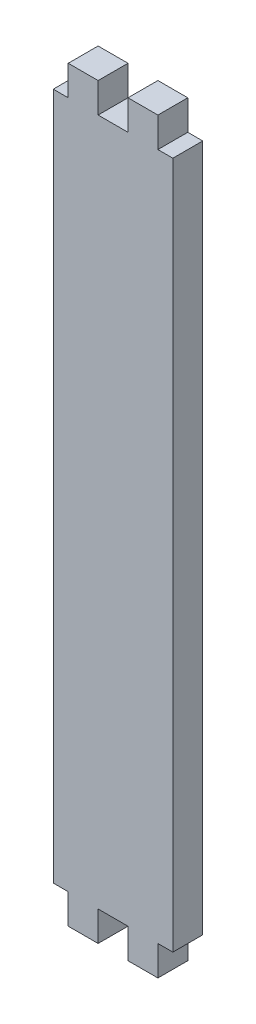
from build123d import *

# Parameters (mm, degrees)
BOSS_EXTRUDE1_DEPTH = 5


with BuildPart() as part:
    # Sketch1 → Boss-Extrude1 (new body)
    with BuildSketch(Plane.XY):
        Polygon((-7.5, 57.5), (-7.5, 62.5), (-2.5, 62.5), (-2.5, 57.5), (2.5, 57.5), (2.5, 62.5), (7.5, 62.5), (7.5, 57.5), (10, 57.5), (10, -57.5), (7.5, -57.5), (7.5, -62.5), (2.5, -62.5), (2.5, -57.5), (-2.5, -57.5), (-2.5, -62.5), (-7.5, -62.5), (-7.5, -57.5), (-10, -57.5), (-10, 57.5), align=None)
    extrude(amount=BOSS_EXTRUDE1_DEPTH)


solid = part.part
